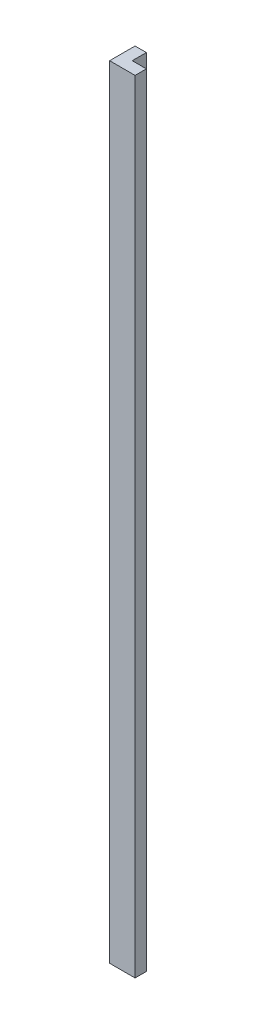
from build123d import *

# Parameters (mm, degrees)
BOSS_EXTRUDE1_DEPTH = 7023.1


with BuildPart() as part:
    # Sketch1 → Boss-Extrude1 (new body)
    with BuildSketch(Plane(origin=(0, 0, 0), x_dir=(1, 0, 0), z_dir=(0, 1, 0))):
        Polygon((0, 0), (0, 228.6), (101.6, 228.6), (101.6, 101.6), (228.6, 101.6), (228.6, 0), align=None)
    extrude(amount=BOSS_EXTRUDE1_DEPTH)


solid = part.part
